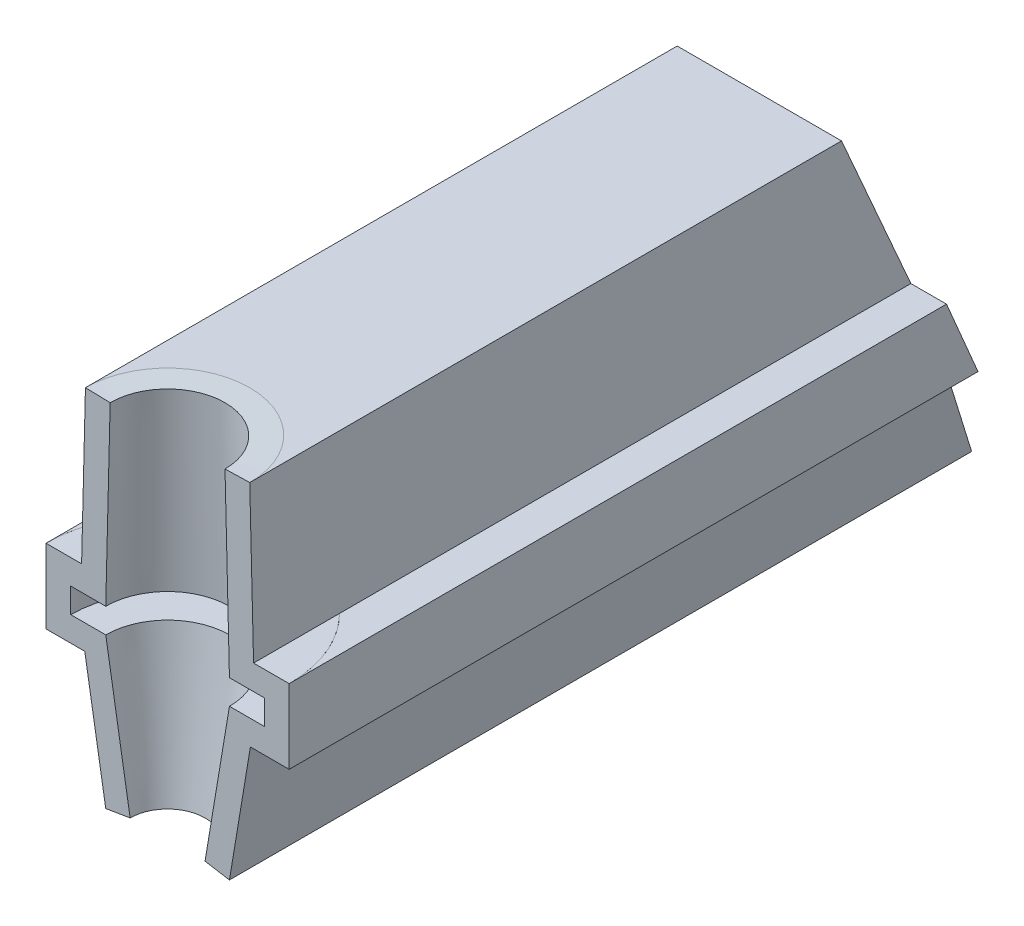
from build123d import *

# Parameters (mm, degrees)
REVOLVE1_ANGLE      = 180
BOSS_EXTRUDE3_REACH = 91.369
BOSS_EXTRUDE3_START = -60
CUT_EXTRUDE1_DEPTH  = 69.233142477


with BuildPart() as part:
    # Sketch1 → Revolve1 (revolve)
    with BuildSketch(Plane.XY):
        Polygon((5.000641399, -2.775851315), (6.694254361, 7.385826457), (9.829278376, 7.385826457), (9.829278376, 13.385826457), (6.950996977, 13.385826457), (6.641252589, 25.870888635), (4.641867801, 25.8212855), (4.999999973, 11.385826457), (7.829278376, 11.385826457), (7.829278376, 9.385826457), (5.000000185, 9.385826457), (3.027853552, -2.447053341), align=None)
    revolve(axis=Axis((0, 0, 0), (0, 1, 0)), revolution_arc=REVOLVE1_ANGLE)


with BuildPart() as body_2:

    # Sketch4 → Boss-Extrude3 (new, up to next)
    with BuildSketch(Plane.XY.offset(BOSS_EXTRUDE3_START), mode=Mode.PRIVATE) as boss_extrude3_sk1:
        Polygon((-6.950996977, 13.385826457), (-9.829278376, 13.385826457), (-9.829278376, 7.385826457), (-6.694254361, 7.385826457), (-5.000641399, -2.775851315), (5.000641399, -2.775851315), (6.694254361, 7.385826457), (9.829278376, 7.385826457), (9.829278376, 13.385826457), (6.950996977, 13.385826457), (6.641252589, 25.870888635), (-6.641252589, 25.870888635), align=None)
    boss_extrude3_tool1 = extrude(boss_extrude3_sk1.sketch, amount=BOSS_EXTRUDE3_REACH, mode=Mode.PRIVATE) - part.part
    add(boss_extrude3_tool1.solids().sort_by_distance((0, 11.933789, -60))[0])

    # Sketch5 → Cut-Extrude1 (cut, through all)
    with BuildSketch(Plane(origin=(9.829278376, 0, 0), x_dir=(0, 0, -1), z_dir=(1, 0, 0))):
        Polygon((60, -2.775851315), (60, 25.870888635), (47.840180325, 25.870888635), align=None)
    extrude(amount=-CUT_EXTRUDE1_DEPTH, mode=Mode.SUBTRACT)


solid = Compound([part.part, body_2.part])
